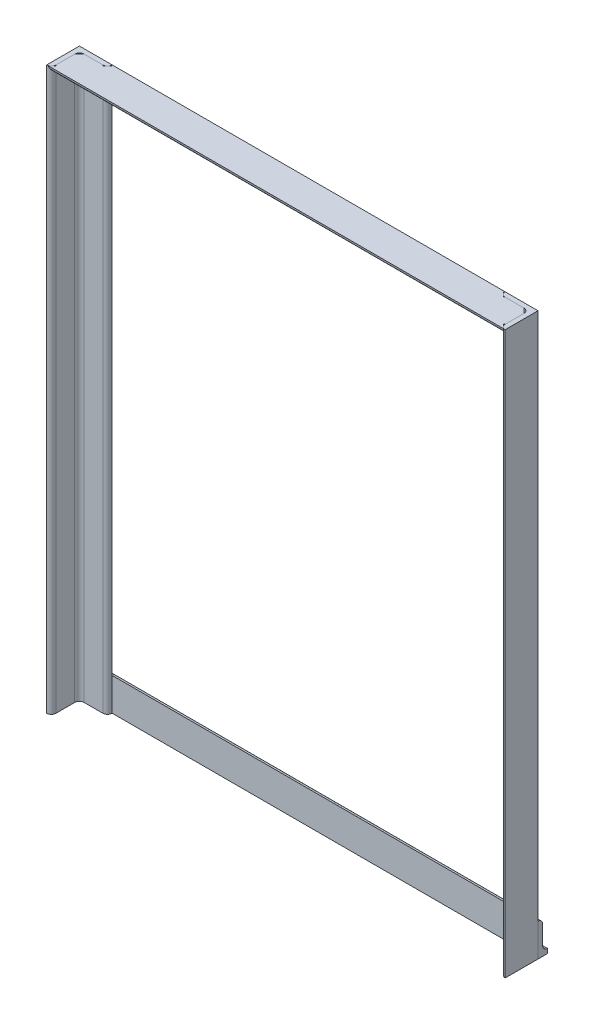
from build123d import *

# Parameters (mm, degrees)
HIERRO_ANGULAR_35_X_35_X_5_1_DEPTH = 600
HIERRO_ANGULAR_35_X_35_X_5_2_DEPTH = 600
HIERRO_ANGULAR_35_X_35_X_5_3_DEPTH = 490
HIERRO_ANGULAR_35_X_35_X_5_5_DEPTH = 490
SALIENTE_EXTRUIR1_REACH            = 391.391
CROQUIS8_R                         = 11
CROQUIS8_R_2                       = 4
RECORTAR_EXTENDER1_START           = 265
RECORTAR_EXTENDER1_DEPTH           = 35
CROQUIS12_W                        = 140
CROQUIS12_H                        = 25
CORTAR_EXTRUIR1_DEPTH              = 10
CHAFL_N1_SIZE                      = 5
CROQUIS13_R                        = 4
CORTAR_EXTRUIR2_DEPTH              = 5
CORTAR_EXTRUIR3_DEPTH              = 5


# Read off the part's stored shape, not the designer's step: Recortar/Extender1
with BuildPart() as part:
    # Sketch1 → Hierro angular 35 X 35 X 5(1) (new body)
    with BuildSketch(Plane(origin=(-245, -300, 0), x_dir=(0, 0, 1), z_dir=(0, 1, 0))):
        with BuildLine():
            Line((0, 0), (0, 35))
            ThreePointArc((0, 35), (3.535533906, 33.535533906), (5, 30))
            Line((5, 30), (5, 10))
            ThreePointArc((5, 10), (6.464466094, 6.464466094), (10, 5))
            Line((10, 5), (30, 5))
            ThreePointArc((30, 5), (33.535533906, 3.535533906), (35, 0))
            Line((35, 0), (0, 0))
        make_face()
    extrude(amount=HIERRO_ANGULAR_35_X_35_X_5_1_DEPTH)


with BuildPart() as body_2:
    # Sketch11 → Hierro angular 35 X 35 X 5(2) (new body)
    with BuildSketch(Plane(origin=(245, -300, 0), x_dir=(-1, 0, 0), z_dir=(0, 1, 0))):
        with BuildLine():
            Line((0, 0), (0, 35))
            ThreePointArc((0, 35), (3.535533906, 33.535533906), (5, 30))
            Line((5, 30), (5, 10))
            ThreePointArc((5, 10), (6.464466094, 6.464466094), (10, 5))
            Line((10, 5), (30, 5))
            ThreePointArc((30, 5), (33.535533906, 3.535533906), (35, 0))
            Line((35, 0), (0, 0))
        make_face()
    extrude(amount=HIERRO_ANGULAR_35_X_35_X_5_2_DEPTH)


with BuildPart() as body_3:
    # Sketch12 → Hierro angular 35 X 35 X 5(3) (new body)
    with BuildSketch(Plane(origin=(-245, 300, 0), x_dir=(0, 0, 1), z_dir=(1, 0, 0))):
        with BuildLine():
            Line((0, 0), (0, 35))
            ThreePointArc((0, 35), (3.535533906, 33.535533906), (5, 30))
            Line((5, 30), (5, 10))
            ThreePointArc((5, 10), (6.464466094, 6.464466094), (10, 5))
            Line((10, 5), (30, 5))
            ThreePointArc((30, 5), (33.535533906, 3.535533906), (35, 0))
            Line((35, 0), (0, 0))
        make_face()
    extrude(amount=HIERRO_ANGULAR_35_X_35_X_5_3_DEPTH)


with BuildPart() as body_4:
    # Sketch14 → Hierro angular 35 X 35 X 5(5) (new body)
    with BuildSketch(Plane(origin=(-245, -300, 0), x_dir=(0, 0, -1), z_dir=(1, 0, 0))):
        with BuildLine():
            Line((0, 0), (0, 35))
            ThreePointArc((0, 35), (3.535533906, 33.535533906), (5, 30))
            Line((5, 30), (5, 10))
            ThreePointArc((5, 10), (6.464466094, 6.464466094), (10, 5))
            Line((10, 5), (30, 5))
            ThreePointArc((30, 5), (33.535533906, 3.535533906), (35, 0))
            Line((35, 0), (0, 0))
        make_face()
    extrude(amount=HIERRO_ANGULAR_35_X_35_X_5_5_DEPTH)

    # Croquis12 → Cortar-Extruir1 (cut)
    with BuildSketch(Plane(origin=(0, -290, 0), x_dir=(-1, 0, 0), z_dir=(0, 1, 0))):
        with Locations((-175, -22.5)):
            Rectangle(CROQUIS12_W, CROQUIS12_H)
        with Locations((175, -22.5)):
            Rectangle(CROQUIS12_W, CROQUIS12_H)
    extrude(amount=-CORTAR_EXTRUIR1_DEPTH, mode=Mode.SUBTRACT)

    # Chaflán1
    chafl_n1_edges = [body_4.edges().sort_by_distance(p)[0] for p in [
        (105, -297.5, -10),
        (-105, -297.5, -10),
    ]]
    chamfer(chafl_n1_edges, length=CHAFL_N1_SIZE)

    # Croquis13 → Cortar-Extruir2 (cut)
    with BuildSketch(Plane.XZ.offset(300)):
        with Locations(Location((0, -25, 0), (0, 0, 270))):
            Circle(CROQUIS13_R)
        with Locations(Location((70, -25, 0), (0, 0, 270))):
            Circle(CROQUIS13_R)
        with Locations(Location((-70, -25, 0), (0, 0, 270))):
            Circle(CROQUIS13_R)
    extrude(amount=-CORTAR_EXTRUIR2_DEPTH, mode=Mode.SUBTRACT)

    # Croquis14 → Cortar-Extruir3 (cut)
    with BuildSketch(Plane.XZ.offset(300)):
        Polygon((-105, -15), (-85, -35), (-105, -35), align=None)
        Polygon((105, -15), (85, -35), (105, -35), align=None)
    extrude(amount=-CORTAR_EXTRUIR3_DEPTH, mode=Mode.SUBTRACT)


with BuildPart() as body_5:

    # Croquis8 → Saliente-Extruir1 (new, up to next)
    with BuildSketch(Plane(origin=(0, 0, -5), x_dir=(-1, 0, 0), z_dir=(0, 0, -1)), mode=Mode.PRIVATE) as saliente_extruir1_sk1:
        with Locations(Location((-227.5, 282.5, 0), (0, 0, 90))):
            Circle(CROQUIS8_R)
        with Locations(Location((-227.5, 282.5, 0), (0, 0, 90))):
            Circle(CROQUIS8_R_2, mode=Mode.SUBTRACT)
    saliente_extruir1_tool1 = extrude(saliente_extruir1_sk1.sketch, amount=-SALIENTE_EXTRUIR1_REACH, mode=Mode.PRIVATE) - body_3.part
    # Croquis8 → Saliente-Extruir1 (new, up to next)
    with BuildSketch(Plane(origin=(0, 0, -5), x_dir=(-1, 0, 0), z_dir=(0, 0, -1)), mode=Mode.PRIVATE) as saliente_extruir1_sk2:
        with Locations(Location((227.5, 282.5, 0), (0, 0, 270))):
            Circle(CROQUIS8_R)
        with Locations(Location((227.5, 282.5, 0), (0, 0, 270))):
            Circle(CROQUIS8_R_2, mode=Mode.SUBTRACT)
    saliente_extruir1_tool2 = extrude(saliente_extruir1_sk2.sketch, amount=-SALIENTE_EXTRUIR1_REACH, mode=Mode.PRIVATE) - body_3.part
    add(saliente_extruir1_tool1.solids().sort_by_distance((227.5, 271.811127, -5))[0])
    add(saliente_extruir1_tool2.solids().sort_by_distance((-227.5, 293.188873, -5))[0])


with BuildPart() as body_3_1:
    add(body_3.part)

    # Recortar/Extender1 outline → Recortar/Extender1 (cut)
    with BuildSketch(Plane(origin=(0, 0, 0), x_dir=(1, 0, 0), z_dir=(0, 1, 0)).offset(RECORTAR_EXTENDER1_START)):
        Polygon((-243.928932188, -36), (-238.964466094, -31.035533906), (-240, -30), (-240, -10), (-235, -5), (-215, -5), (-213.964466094, -6.035533906), (-208.964466094, -1.035533906), (-212, 2), (-245, 2), (-245, -36), align=None)
        Polygon((238.964466094, -31.035533906), (243.928932188, -36), (245, -36), (245, 2), (212, 2), (208.964466094, -1.035533906), (213.964466094, -6.035533906), (215, -5), (235, -5), (240, -10), (240, -30), align=None)
    extrude(amount=RECORTAR_EXTENDER1_DEPTH, mode=Mode.SUBTRACT)


solid = Compound([part.part, body_2.part, body_4.part, body_5.part, body_3_1.part])
